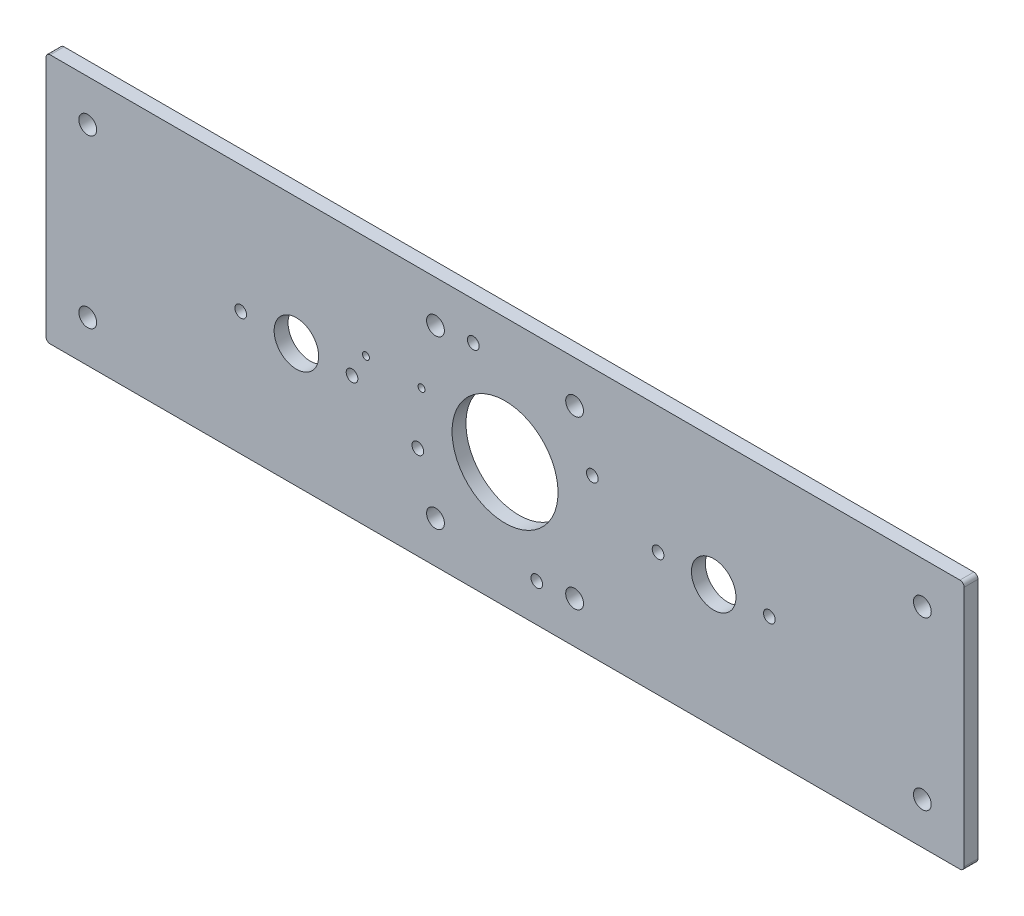
from build123d import *

# Parameters (mm, degrees)
SKETCH1_W             = 330
SKETCH1_H             = 90
SKETCH1_R             = 19.05
BOSS_EXTRUDE1_DEPTH   = 2.5
M6_CLEARANCE_HOLE1_D  = 6.4
SKETCH3_R             = 8
CUT_EXTRUDE2_DEPTH    = 172.099386323
M5X0_8_TAPPED_HOLE1_D = 4.2
M5X0_8_TAPPED_HOLE3_D = 4.2
FILLET1_R             = 1.5
M3X0_5_TAPPED_HOLE1_D = 2.5


with BuildPart() as part:
    # Sketch1 → Boss-Extrude1 (new, symmetric)
    with BuildSketch(Plane.XY):
        Rectangle(SKETCH1_W, SKETCH1_H)
        Circle(SKETCH1_R, mode=Mode.SUBTRACT)
    extrude(amount=BOSS_EXTRUDE1_DEPTH, both=True)

    # M6 Clearance Hole1 (through all)
    with Locations(Plane.XY.offset(2.5)):
        with Locations((-150, 30), (-25, 30), (-25, -30), (-150, -30)):
            m6_clearance_hole1 = Hole(M6_CLEARANCE_HOLE1_D / 2)

    # Mirror2: M6 Clearance Hole1 across plane
    add(m6_clearance_hole1.mirror(Plane(origin=(0, 0, 0), x_dir=(0, 0, 1), z_dir=(1, 0, 0))), mode=Mode.SUBTRACT)

    # Sketch3 → Cut-Extrude2 (cut, through all)
    with BuildSketch(Plane.XY.offset(2.5)):
        with Locations((-75, -0.6)):
            Circle(SKETCH3_R)
    cut_extrude2 = extrude(amount=-CUT_EXTRUDE2_DEPTH, mode=Mode.SUBTRACT)

    # M5x0.8 Tapped Hole1 (through all)
    with Locations(Plane.XY.offset(2.5)):
        with Locations((-95, -0.6), (-55, -0.6)):
            m5x0_8_tapped_hole1 = Hole(M5X0_8_TAPPED_HOLE1_D / 2)

    # Mirror1: Cut-Extrude2, M5x0.8 Tapped Hole1 across plane
    add(cut_extrude2.mirror(Plane(origin=(0, 0, 0), x_dir=(0, 0, 1), z_dir=(1, 0, 0))), mode=Mode.SUBTRACT)
    add(m5x0_8_tapped_hole1.mirror(Plane(origin=(0, 0, 0), x_dir=(0, 0, 1), z_dir=(1, 0, 0))), mode=Mode.SUBTRACT)

    # M5x0.8 Tapped Hole3 (through all)
    with Locations(Plane.XY.offset(2.5)):
        with Locations((-11.415072797, 31.362654751), (11.415072797, -31.362654751), (-31.362654751, -11.415072797), (31.362654751, 11.415072797)):
            Hole(M5X0_8_TAPPED_HOLE3_D / 2)

    # Fillet1
    fillet1_edges = [part.edges().sort_by_distance(p)[0] for p in [
        (-165, -45, 0),
        (165, -45, 0),
        (165, 45, 0),
        (-165, 45, 0),
    ]]
    fillet(fillet1_edges, radius=FILLET1_R)

    # M3x0.5 Tapped Hole1 (through all)
    with Locations(Plane.XY.offset(2.5)):
        with Locations((-50, 8), (-30, 8)):
            Hole(M3X0_5_TAPPED_HOLE1_D / 2)


solid = part.part
